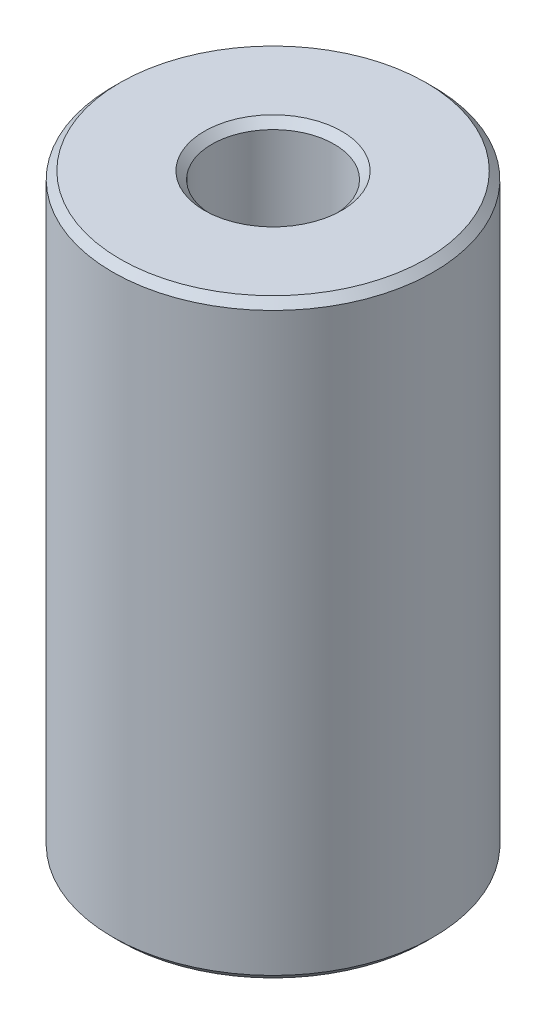
from build123d import *

# Parameters (mm, degrees)
SKETCH1_R           = 40
BOSS_EXTRUDE1_DEPTH = 147.345333261
SKETCH2_R           = 15.256180903
CUT_EXTRUDE1_DEPTH  = 158.831071826
CHAMFER1_SIZE       = 1.872538463


with BuildPart() as part:
    # Sketch1 → Boss-Extrude1 (new body)
    with BuildSketch(Plane(origin=(0, 0, 0), x_dir=(1, 0, 0), z_dir=(0, 1, 0))):
        Circle(SKETCH1_R)
    extrude(amount=BOSS_EXTRUDE1_DEPTH)

    # Sketch2 → Cut-Extrude1 (cut, through all)
    with BuildSketch(Plane(origin=(0, 0, 0), x_dir=(1, 0, 0), z_dir=(0, 1, 0))):
        Circle(SKETCH2_R)
    extrude(amount=CUT_EXTRUDE1_DEPTH, mode=Mode.SUBTRACT)

    # Chamfer1
    chamfer1_edges = [part.edges().sort_by_distance(p)[0] for p in [
        (-15.256180903, 147.345333261, 0),
        (-15.256180903, 0, 0),
        (-40, 0, 0),
        (-40, 147.345333261, 0),
    ]]
    chamfer(chamfer1_edges, length=CHAMFER1_SIZE)


solid = part.part
